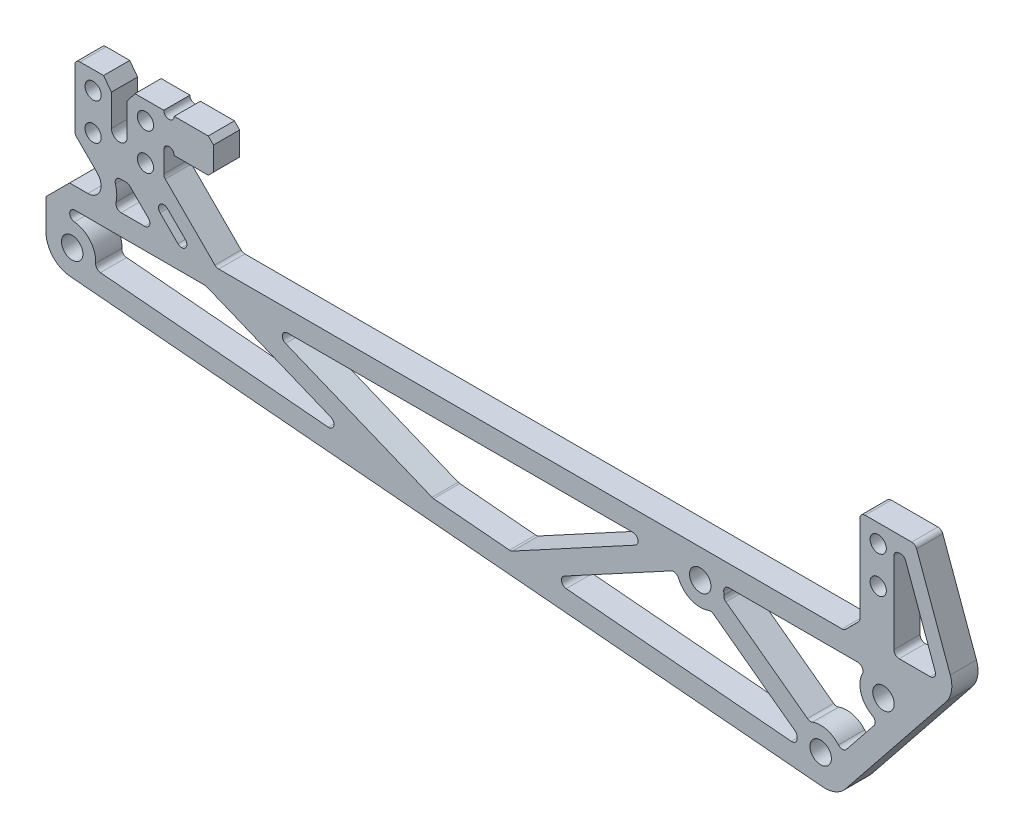
from build123d import *

# Parameters (mm, degrees)
SKETCH_1_R           = 1.55
EXTRUDE_1_DEPTH      = 2.5
FILLET_1_R           = 1
CHAMFER_1_SIZE       = 3
SKETCH_3_R           = 2.05
CUT_EXTRUDE_1_DEPTH  = 178.05212527
CUT_EXTRUDE_2_DEPTH  = 178.05212527
CUT_EXTRUDE_3_DEPTH  = 166.292604008
FILLET_2_R           = 1
CHAMFER_2_SIZE       = 4.5
FILLET_4_R           = 5
EXTRUDE_3_DEPTH      = 5
FILLET_5_R           = 1
FILLET_7_R           = 1
CUT_EXTRUDE_4_DEPTH  = 165.600736622
FILLET_8_R           = 1
CUT_EXTRUDE_5_DEPTH  = 165.600736622
EXTRUDE_5_DEPTH      = 5
CUT_EXTRUDE_6_DEPTH  = 165.600736622
FILLET_9_R           = 1
CUT_EXTRUDE_7_DEPTH  = 165.600736622
SKETCH_13_R          = 4.5
SKETCH_13_R_2        = 2.05
EXTRUDE_6_DEPTH      = 5
FILLET_10_R          = 1
EXTRUDE_7_DEPTH      = 5
FILLET_11_R          = 1
EXTRUDE_8_DEPTH      = 5
SKETCH_17_R          = 1
CUT_EXTRUDE_9_DEPTH  = 165.600736622
CHAMFER_3_SIZE       = 1
SKETCH_18_R          = 2.05
CUT_EXTRUDE_10_DEPTH = 165.600736622


with BuildPart() as part:
    # 草图1 → 凸台-拉伸1 (new, symmetric)
    with BuildSketch(Plane.XY):
        with BuildLine():
            Line((-6, -14.025), (-14, -14.025))
            Line((-14, -14.025), (-14, -29.025))
            Line((-14, -29.025), (171.107064417, -45.219769675))
            Line((171.107064417, -45.219769675), (152.100622615, 7))
            Line((152.100622615, 7), (141.5, 7))
            Line((141.5, 7), (141.5, -14.025))
            Line((141.5, -14.025), (8.5, -14.025))
            Line((8.5, -14.025), (8.5, 7))
            Line((8.5, 7), (-8.5, 7))
            Line((-8.5, 7), (-8.5, -8.975))
            Line((-8.5, -8.975), (-6, -8.975))
            ThreePointArc((-6, -8.975), (-3.475, -11.5), (-6, -14.025))
        make_face()
        with Locations((-5, 3.5)):
            Circle(SKETCH_1_R, mode=Mode.SUBTRACT)
        with Locations((5, 3.5)):
            Circle(SKETCH_1_R, mode=Mode.SUBTRACT)
        with Locations((-5, -3.5)):
            Circle(SKETCH_1_R, mode=Mode.SUBTRACT)
        with Locations((5, -3.5)):
            Circle(SKETCH_1_R, mode=Mode.SUBTRACT)
        with Locations((145, 3.5)):
            Circle(SKETCH_1_R, mode=Mode.SUBTRACT)
        with Locations((145, -3.5)):
            Circle(SKETCH_1_R, mode=Mode.SUBTRACT)
        Polygon((148, 4), (148, -13.5), (156.3694791, -13.5), (150, 4), align=None, mode=Mode.SUBTRACT)
    extrude(amount=EXTRUDE_1_DEPTH, both=True)

    # 圆角1
    fillet_1_edges = [part.edges().sort_by_distance(p)[0] for p in [
        (141.5, 7, 0),
        (152.100622615, 7, 0),
        (156.3694791, -13.5, 0),
        (150, 4, 0),
        (148, 4, 0),
        (148, -13.5, 0),
    ]]
    fillet(fillet_1_edges, radius=FILLET_1_R)

    # 倒角1
    chamfer_1_edges = [part.edges().sort_by_distance(p)[0] for p in [
        (8.5, -14.025, 0),
        (141.5, -14.025, 0),
    ]]
    chamfer(chamfer_1_edges, length=CHAMFER_1_SIZE)

    # 草图3 → 切除-拉伸1 (cut, through all)
    with BuildSketch(Plane.XY.offset(2.5)):
        with Locations((-9, -24.5)):
            Circle(SKETCH_3_R)
        with Locations((146, -21.5)):
            Circle(SKETCH_3_R)
        with Locations((134, -36.5)):
            Circle(SKETCH_3_R)
    extrude(amount=-CUT_EXTRUDE_1_DEPTH, mode=Mode.SUBTRACT)

    # 草图4 → 切除-拉伸2 (cut, through all)
    with BuildSketch(Plane.XY.offset(2.5)):
        Polygon((159.725158013, -13.94823884), (137.088896577, -42.243565635), (171.107064417, -45.219769675), align=None)
    extrude(amount=-CUT_EXTRUDE_2_DEPTH, mode=Mode.SUBTRACT)

    # 草图5 → 切除-拉伸3 (cut, through all)
    with BuildSketch(Plane.XY.offset(2.5)):
        with BuildLine():
            Line((-12.181980515, -21.318019485), (-8.888961031, -18.025))
            Line((-8.888961031, -18.025), (143.140913607, -18.025))
            ThreePointArc((143.140913607, -18.025), (141.625936704, -22.557151967), (145.043511375, -25.8971729))
            Line((145.043511375, -25.8971729), (138.079963863, -34.60160729))
            ThreePointArc((138.079963863, -34.60160729), (132.505892934, -32.255280448), (129.630475707, -37.575759011))
            Line((129.630475707, -37.575759011), (-4.699014499, -25.823451441))
            ThreePointArc((-4.699014499, -25.823451441), (-6.678842462, -20.644844013), (-12.181980515, -21.318019485))
        make_face()
    extrude(amount=-CUT_EXTRUDE_3_DEPTH, mode=Mode.SUBTRACT)

    # 圆角2
    fillet_2_edges = [part.edges().sort_by_distance(p)[0] for p in [
        (-4.699014499, -25.823451441, 0),
        (-8.888961031, -18.025, 0),
        (143.140913607, -18.025, 0),
        (145.043511375, -25.8971729, 0),
        (138.079963863, -34.60160729, 0),
        (129.630475707, -37.575759011, 0),
    ]]
    fillet(fillet_2_edges, radius=FILLET_2_R)
    fillet_2_2_edges = [part.edges().sort_by_distance(p)[0] for p in [
        (-12.181980515, -21.318019485, 0),
    ]]
    fillet(fillet_2_2_edges, radius=FILLET_2_R)

    # 倒角2
    chamfer_2_edges = [part.edges().sort_by_distance(p)[0] for p in [
        (-14, -14.025, 0),
    ]]
    chamfer(chamfer_2_edges, length=CHAMFER_2_SIZE)

    # 圆角4
    fillet_4_edges = [part.edges().sort_by_distance(p)[0] for p in [
        (159.725158013, -13.94823884, 0),
        (137.088896577, -42.243565635, 0),
        (-14, -29.025, 0),
    ]]
    fillet(fillet_4_edges, radius=FILLET_4_R)

    # 草图7 → 凸台-拉伸3 (add)
    with BuildSketch(Plane.XY.offset(2.5)):
        Polygon((16.525252532, -18.025), (46.483701437, -30.301358854), (59.896469489, -31.474824005), (27.074370524, -18.025), align=None)
        Polygon((102.074370524, -18.025), (74.83938996, -32.782160146), (82.068385362, -33.414615292), (110.470589391, -18.025), align=None)
    extrude(amount=-EXTRUDE_3_DEPTH)

    # 圆角5
    fillet_5_edges = [part.edges().sort_by_distance(p)[0] for p in [
        (16.525252532, -18.025, 0),
        (27.074370524, -18.025, 0),
        (59.896469489, -31.474824005, 0),
        (46.483701437, -30.301358854, 0),
        (102.074370524, -18.025, 0),
        (110.470589391, -18.025, 0),
        (82.068385362, -33.414615292, 0),
        (74.83938996, -32.782160146, 0),
    ]]
    fillet(fillet_5_edges, radius=FILLET_5_R)

    # 圆角7
    fillet_7_edges = [part.edges().sort_by_distance(p)[0] for p in [
        (-8.5, 7, 0),
        (8.5, 7, 0),
    ]]
    fillet(fillet_7_edges, radius=FILLET_7_R)

    # 草图8 → 切除-拉伸4 (cut, through all)
    with BuildSketch(Plane.XY.offset(2.5)):
        with BuildLine():
            Line((1.732359313, -8.5), (7.257359313, -14.025))
            Line((7.257359313, -14.025), (-1.08573505, -14.025))
            ThreePointArc((-1.08573505, -14.025), (-0.481816001, -11.225645569), (-1.36042836, -8.5))
            Line((-1.36042836, -8.5), (1.732359313, -8.5))
        make_face()
    extrude(amount=-CUT_EXTRUDE_4_DEPTH, mode=Mode.SUBTRACT)

    # 圆角8
    fillet_8_edges = [part.edges().sort_by_distance(p)[0] for p in [
        (-1.36042836, -8.5, 0),
        (1.732359313, -8.5, 0),
        (7.257359313, -14.025, 0),
        (-1.08573505, -14.025, 0),
    ]]
    fillet(fillet_8_edges, radius=FILLET_8_R)

    # 草图9 → 切除-拉伸5 (cut, through all)
    with BuildSketch(Plane.XY.offset(2.5)):
        Polygon((8.5, -11.025), (7.085786438, -9.610786438), (8.5, -8.196572875), align=None)
    extrude(amount=-CUT_EXTRUDE_5_DEPTH, mode=Mode.SUBTRACT)

    # 草图10 → 凸台-拉伸5 (add)
    with BuildSketch(Plane.XY.offset(2.5)):
        Polygon((8.5, -8.196572875), (14.328427125, -14.025), (18.571067812, -14.025), (8.5, -3.953932188), align=None)
    extrude(amount=-EXTRUDE_5_DEPTH)

    # 草图11 → 切除-拉伸6 (cut, through all)
    with BuildSketch(Plane.XY.offset(2.5)):
        with BuildLine():
            Line((-4.214555378, -9.714555378), (-8.5, -5.429110755))
            Line((-8.5, -5.429110755), (-8.5, -8.975))
            Line((-8.5, -8.975), (-6, -8.975))
            ThreePointArc((-6, -8.975), (-5.033724333, -9.16720418), (-4.214555378, -9.714555378))
        make_face()
    extrude(amount=-CUT_EXTRUDE_6_DEPTH, mode=Mode.SUBTRACT)

    # 圆角9
    fillet_9_edges = [part.edges().sort_by_distance(p)[0] for p in [
        (8.5, -3.953932188, 0),
        (18.571067812, -14.025, 0),
        (14.328427125, -14.025, 0),
        (11.5, -14.025, 0),
        (138.5, -14.025, 0),
        (7.085786438, -9.610786438, 0),
        (8.5, -8.196572875, 0),
        (-8.5, -5.429110755, 0),
        (141.5, -11.025, 0),
    ]]
    fillet(fillet_9_edges, radius=FILLET_9_R - 0.0001)  # a hair under: the kernel refuses the full size

    # 草图12 → 切除-拉伸7 (cut, through all)
    with BuildSketch(Plane.XY.offset(2.5)):
        with BuildLine():
            Line((-3, 7), (-1.5, 5))
            Line((-1.5, 5), (-1.5, -1))
            ThreePointArc((-1.5, -1), (0, -2.5), (1.5, -1))
            Line((1.5, -1), (1.5, 5))
            Line((1.5, 5), (3, 7))
            Line((3, 7), (-3, 7))
        make_face()
    extrude(amount=-CUT_EXTRUDE_7_DEPTH, mode=Mode.SUBTRACT)

    # 草图13 → 凸台-拉伸6 (add)
    with BuildSketch(Plane.XY.offset(2.5)):
        with Locations((111, -19.5)):
            Circle(SKETCH_13_R)
        with Locations((111, -19.5)):
            Circle(SKETCH_13_R_2, mode=Mode.SUBTRACT)
    extrude(amount=-EXTRUDE_6_DEPTH)

    # 圆角10
    fillet_10_edges = [part.edges().sort_by_distance(p)[0] for p in [
        (106.547310536, -20.150812215, 0),
    ]]
    fillet(fillet_10_edges, radius=FILLET_10_R)

    # 草图15 → 凸台-拉伸7 (add)
    with BuildSketch(Plane.XY.offset(2.5)):
        with BuildLine():
            Line((113.052955542, -23.504419252), (129.569480214, -35.712285314))
            ThreePointArc((129.569480214, -35.712285314), (130.381207363, -33.825240225), (131.947044458, -32.495580748))
            Line((131.947044458, -32.495580748), (115.430519786, -20.287714686))
            ThreePointArc((115.430519786, -20.287714686), (114.618792637, -22.174759775), (113.052955542, -23.504419252))
        make_face()
    extrude(amount=-EXTRUDE_7_DEPTH)

    # 圆角11
    fillet_11_edges = [part.edges().sort_by_distance(p)[0] for p in [
        (115.251396829, -18.025, 0),
        (113.052955542, -23.504419252, 0),
        (115.430519786, -20.287714686, 0),
        (131.947044458, -32.495580748, 0),
        (129.569480214, -35.712285314, 0),
    ]]
    fillet(fillet_11_edges, radius=FILLET_11_R)

    # 草图16 → 凸台-拉伸8 (add)
    with BuildSketch(Plane.XY.offset(2.5)):
        with BuildLine():
            Line((7.5, 7), (18, 7))
            Line((18, 7), (18, 0.5))
            Line((18, 0.5), (8.5, 0.5))
            Line((8.5, 0.5), (8.5, 6))
            ThreePointArc((8.5, 6), (8.207106781, 6.707106781), (7.5, 7))
        make_face()
    extrude(amount=-EXTRUDE_8_DEPTH)

    # 草图17 → 切除-拉伸9 (cut, through all)
    with BuildSketch(Plane.XY.offset(2.5)):
        with Locations((9.5, 0.5)):
            Circle(SKETCH_17_R)
        with Locations((9.5, 7)):
            Circle(SKETCH_17_R)
    extrude(amount=-CUT_EXTRUDE_9_DEPTH, mode=Mode.SUBTRACT)

    # 倒角3
    chamfer_3_edges = [part.edges().sort_by_distance(p)[0] for p in [
        (18, 7, 0),
        (18, 0.5, 0),
    ]]
    chamfer(chamfer_3_edges, length=CHAMFER_3_SIZE)

    # 草图18 → 切除-拉伸10 (cut, through all)
    with BuildSketch(Plane.XY.offset(2.5)):
        with Locations((111, -19.5)):
            Circle(SKETCH_18_R)
    extrude(amount=-CUT_EXTRUDE_10_DEPTH, mode=Mode.SUBTRACT)


solid = part.part
